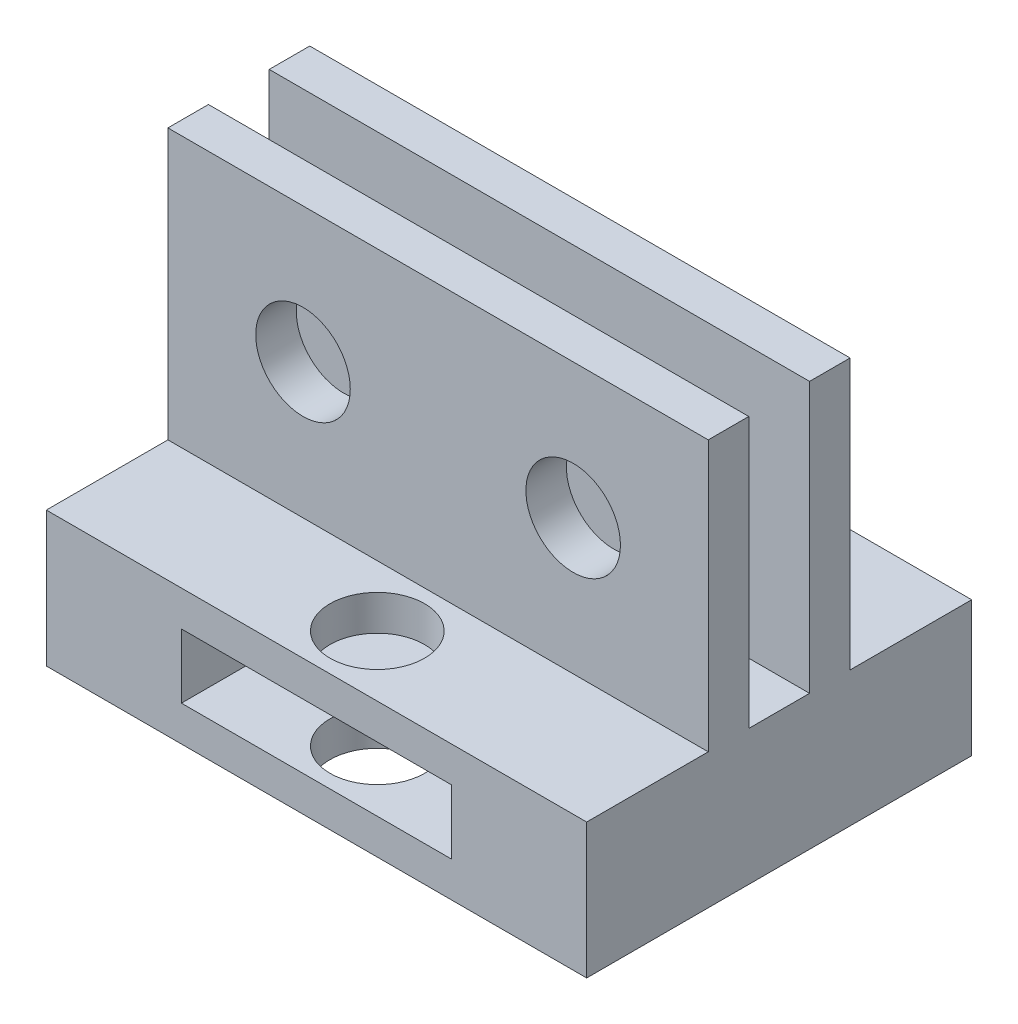
from build123d import *

# Parameters (mm, degrees)
SKETCH1_W                = 40
SKETCH1_H                = 30
SKETCH1_R                = 3.5
SKETCH1_W_2              = 20
SKETCH1_H_2              = 4.76
BOSS_EXTRUDE1_DEPTH      = 3
BOSS_EXTRUDE3_START      = -7.5
SKETCH1_5_W              = 40
SKETCH1_5_H              = 30
SKETCH1_5_R              = 3.5
SKETCH1_5_W_2            = 20
SKETCH1_5_H_2            = 4.76
BOSS_EXTRUDE3_DEPTH      = 7.5
CUT_EXTRUDE1_START       = -4.5
SKETCH1_6_W              = 40
SKETCH1_6_H              = 20
SKETCH1_6_R              = 3.5
CUT_EXTRUDE1_DEPTH       = 4.5
BOSS_EXTRUDE4_DEPTH      = 12
BOSS_EXTRUDE4_DEPTH_BACK = 16.5
SKETCH1_7_W              = 40
SKETCH1_7_H              = 10
SKETCH1_7_W_2            = 20
SKETCH1_7_H_2            = 4.76
SKETCH5_R                = 3.5
CUT_EXTRUDE2_DEPTH       = 10


with BuildPart() as part:
    # Sketch1 → Boss-Extrude1 (new body)
    with BuildSketch(Plane.XY):
        with Locations((-26.342010442, -115)):
            Rectangle(SKETCH1_W, SKETCH1_H)
        with Locations((-36.342010442, -110)):
            Circle(SKETCH1_R, mode=Mode.SUBTRACT)
        with Locations((-16.342010442, -110)):
            Circle(SKETCH1_R, mode=Mode.SUBTRACT)
        with Locations((-26.342010442, -125)):
            Rectangle(SKETCH1_W_2, SKETCH1_H_2, mode=Mode.SUBTRACT)
    extrude(amount=BOSS_EXTRUDE1_DEPTH)

    # Sketch1<5> → Boss-Extrude3 (add)
    with BuildSketch(Plane.XY.offset(BOSS_EXTRUDE3_START)):
        with Locations((-26.342010442, -115)):
            Rectangle(SKETCH1_5_W, SKETCH1_5_H)
        with Locations((-36.342010442, -110)):
            Circle(SKETCH1_5_R, mode=Mode.SUBTRACT)
        with Locations((-16.342010442, -110)):
            Circle(SKETCH1_5_R, mode=Mode.SUBTRACT)
        with Locations((-26.342010442, -125)):
            Rectangle(SKETCH1_5_W_2, SKETCH1_5_H_2, mode=Mode.SUBTRACT)
    extrude(amount=BOSS_EXTRUDE3_DEPTH)

    # Sketch1<6> → Cut-Extrude1 (cut)
    with BuildSketch(Plane.XY.offset(CUT_EXTRUDE1_START)):
        with Locations((-26.342010442, -110)):
            Rectangle(SKETCH1_6_W, SKETCH1_6_H)
        with Locations((-36.342010442, -110)):
            Circle(SKETCH1_6_R, mode=Mode.SUBTRACT)
        with Locations((-16.342010442, -110)):
            Circle(SKETCH1_6_R, mode=Mode.SUBTRACT)
    extrude(amount=CUT_EXTRUDE1_DEPTH, mode=Mode.SUBTRACT)

    # Sketch1<7> → Boss-Extrude4 (add, two sides: drawn at the far end of the back side and taken through both)
    with BuildSketch(Plane.XY.offset(-BOSS_EXTRUDE4_DEPTH_BACK)):
        with Locations((-26.342010442, -125)):
            Rectangle(SKETCH1_7_W, SKETCH1_7_H)
        with Locations((-26.342010442, -125)):
            Rectangle(SKETCH1_7_W_2, SKETCH1_7_H_2, mode=Mode.SUBTRACT)
    extrude(amount=BOSS_EXTRUDE4_DEPTH + BOSS_EXTRUDE4_DEPTH_BACK)

    # Sketch5 → Cut-Extrude2 (cut)
    with BuildSketch(Plane.XZ.offset(130)):
        with Locations((-26.342010442, 7.5)):
            Circle(SKETCH5_R)
        with Locations((-26.342010442, -12)):
            Circle(SKETCH5_R)
    extrude(amount=-CUT_EXTRUDE2_DEPTH, mode=Mode.SUBTRACT)


solid = part.part
